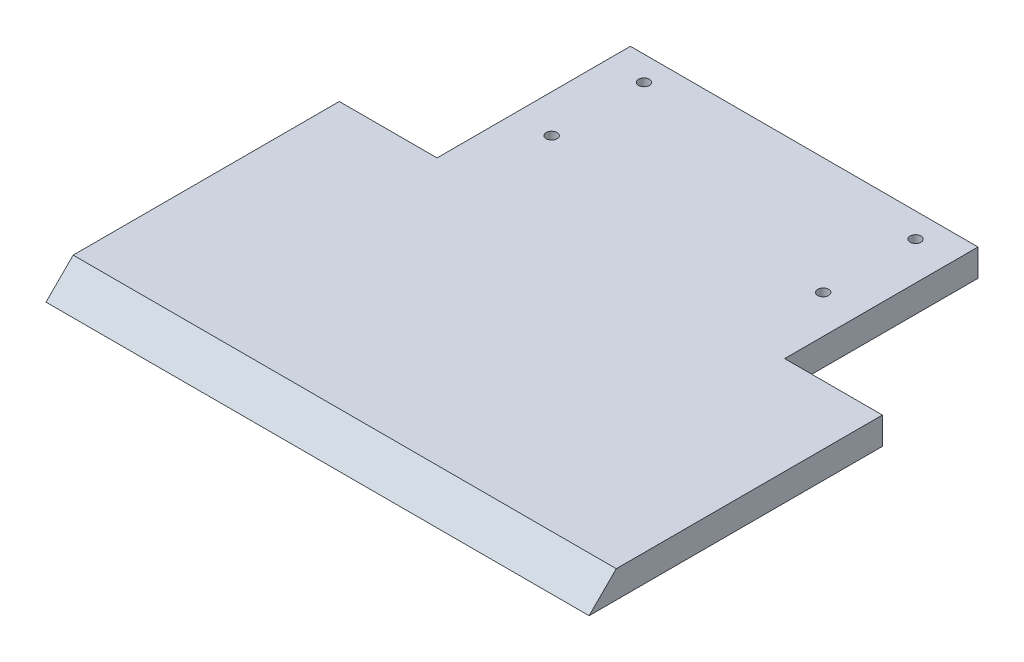
from build123d import *

# Parameters (mm, degrees)
CROQUIS2_W              = 100
CROQUIS2_H              = 99.2
SALIENTE_EXTRUIR1_DEPTH = 5
CHAFL_N1_SIZE           = 5
CROQUIS3_W              = 18
CROQUIS3_H              = 45.2
CORTAR_EXTRUIR1_DEPTH   = 5
CROQUIS6_R              = 1
CORTAR_EXTRUIR3_DEPTH   = 10
CROQUIS8_W              = 64
CROQUIS8_H              = 9.6
CORTAR_EXTRUIR4_DEPTH   = 141.94552139


with BuildPart() as part:
    # Croquis2 → Saliente-Extruir1 (new body)
    with BuildSketch(Plane(origin=(0, 0, 0), x_dir=(1, 0, 0), z_dir=(0, 1, 0))):
        with Locations((50, 49.6)):
            Rectangle(CROQUIS2_W, CROQUIS2_H)
    extrude(amount=SALIENTE_EXTRUIR1_DEPTH)

    # Chaflán1
    chafl_n1_edges = [part.edges().sort_by_distance(p)[0] for p in [
        (50, 5, 0),
    ]]
    chamfer(chafl_n1_edges, length=CHAFL_N1_SIZE - 0.0001)  # a hair under: the kernel refuses the full size

    # Croquis3 → Cortar-Extruir1 (cut)
    with BuildSketch(Plane(origin=(0, 5, 0), x_dir=(1, 0, 0), z_dir=(0, 1, 0))):
        with Locations((9, 76.6)):
            Rectangle(CROQUIS3_W, CROQUIS3_H)
        with Locations((91, 76.6)):
            Rectangle(CROQUIS3_W, CROQUIS3_H)
    extrude(amount=-CORTAR_EXTRUIR1_DEPTH, mode=Mode.SUBTRACT)

    # Croquis6 → Cortar-Extruir3 (cut)
    with BuildSketch(Plane(origin=(0, 5, 0), x_dir=(1, 0, 0), z_dir=(0, 1, 0))):
        with Locations(Location((25, 85.1, 0), (0, 0, 270))):
            Circle(CROQUIS6_R)
        with Locations(Location((25, 68.1, 0), (0, 0, 270))):
            Circle(CROQUIS6_R)
        with Locations(Location((75, 85.1, 0), (0, 0, 270))):
            Circle(CROQUIS6_R)
        with Locations(Location((75, 68.1, 0), (0, 0, 270))):
            Circle(CROQUIS6_R)
    extrude(amount=-CORTAR_EXTRUIR3_DEPTH, mode=Mode.SUBTRACT)

    # Croquis8 → Cortar-Extruir4 (cut, through all)
    with BuildSketch(Plane(origin=(0, 5, 0), x_dir=(1, 0, 0), z_dir=(0, 1, 0))):
        with Locations((50, 94.4)):
            Rectangle(CROQUIS8_W, CROQUIS8_H)
    extrude(amount=-CORTAR_EXTRUIR4_DEPTH, mode=Mode.SUBTRACT)


solid = part.part
